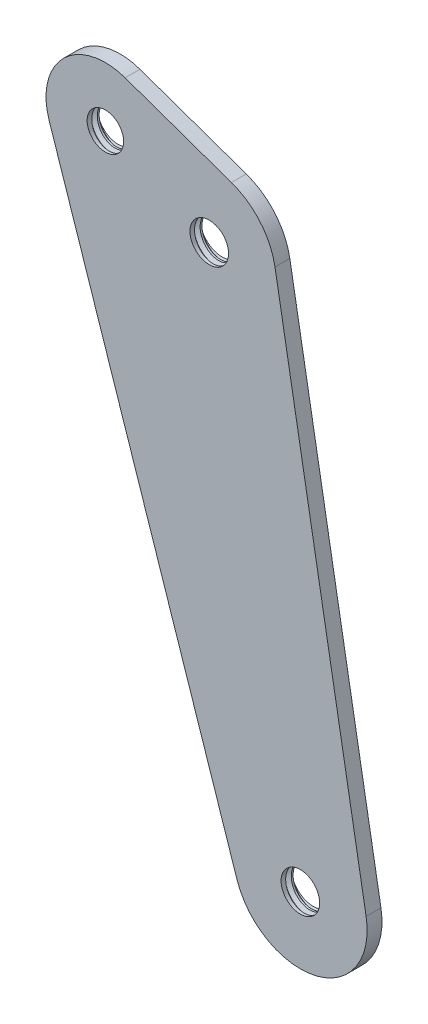
from build123d import *

# Parameters (mm, degrees)
SK_PLACA_JAULA_EXTERIOR_R   = 2.46
SK_PLACA_JAULA_EXTERIOR_R_2 = 2.6
PLACA_JAULA_EXTERIOR_DEPTH  = 2
ROSCA_M6X1_PITCH            = 1
ROSCA1_PITCH                = 1
ROSCA2_PITCH                = 1


with BuildPart() as part:
    # Sk_Placa_jaula_exterior → Placa_jaula_exterior (new body)
    with BuildSketch(Plane.XY.offset(4.2)):
        with BuildLine():
            Line((-43.589272619, -64.530403351), (-18.252323126, -140.521852295))
            ThreePointArc((-18.252323126, -140.521852295), (-7.503629985, -146.399398283), (-0.851121653, -136.112314927))
            Line((-0.851121653, -136.112314927), (-13.136730223, -66.437166401))
            ThreePointArc((-13.136730223, -66.437166401), (-15.134246462, -62.180942658), (-19.005478688, -59.512783606))
            Line((-19.005478688, -59.512783606), (-33.338203279, -54.45580765))
            ThreePointArc((-33.338203279, -54.45580765), (-41.60752836, -56.294246265), (-43.589272619, -64.530403351))
        make_face()
        with Locations((-36, -62)):
            Circle(SK_PLACA_JAULA_EXTERIOR_R, mode=Mode.SUBTRACT)
        with Locations((-22, -68)):
            Circle(SK_PLACA_JAULA_EXTERIOR_R_2, mode=Mode.SUBTRACT)
        with Locations((-9.71439143, -137.675148526)):
            Circle(SK_PLACA_JAULA_EXTERIOR_R_2, mode=Mode.SUBTRACT)
    extrude(amount=PLACA_JAULA_EXTERIOR_DEPTH)

    # Rosca_M6x1: the profile of Perfil de rosca1 profile screwed along a right-hand helix of 2 turns, 8 arcs to a turn; built about Z, then put on its axis
    rosca_m6x1_z = Axis((0, 0, 0), (0, 0, 1))
    rosca_m6x1_corners = [(2.4597, 0, -0.000173205), (3.001265875, 0, 0.312499999), (3.001265875, 0, 0.437499999), (2.4597, 0, 0.750173202)]
    with BuildLine(mode=Mode.PRIVATE) as rosca_m6x1_profile:
        Line(rosca_m6x1_corners[0], rosca_m6x1_corners[1])
        Line(rosca_m6x1_corners[1], rosca_m6x1_corners[2])
        Line(rosca_m6x1_corners[2], rosca_m6x1_corners[3])
        Line(rosca_m6x1_corners[3], rosca_m6x1_corners[0])
    rosca_m6x1_cap = Face(rosca_m6x1_profile.wire())
    rosca_m6x1_turn_angles = [0, 22.5, 45, 67.5, 90, 112.5, 135, 157.5, 180, 202.5, 225, 247.5, 270, 292.5, 315, 337.5, 360]
    rosca_m6x1_turn_weights = [1, 0.9238795325112867, 1, 0.9238795325112867, 1, 0.9238795325112867, 1, 0.9238795325112867, 1, 0.9238795325112867, 1, 0.9238795325112867, 1, 0.9238795325112867, 1, 0.9238795325112867, 1]
    rosca_m6x1_turn_rails = [Edge.make_bspline([Vector(p[0], p[1], 0).rotate(rosca_m6x1_z, rosca_m6x1_turn_angles[k]) / rosca_m6x1_turn_weights[k] + Vector(0, 0, p[2] + ROSCA_M6X1_PITCH * rosca_m6x1_turn_angles[k] / 360) for k in range(17)], [0, 0, 0, 1, 1, 2, 2, 3, 3, 4, 4, 5, 5, 6, 6, 7, 7, 8, 8, 8], 2, rosca_m6x1_turn_weights) for p in rosca_m6x1_corners]
    rosca_m6x1_turn_sides = [Face.make_surface_from_curves(rosca_m6x1_turn_rails[p[0]], rosca_m6x1_turn_rails[p[1]]) for p in [(0, 1), (1, 2), (2, 3), (3, 0)]]
    rosca_m6x1 = Plane(origin=(-36, -62, 6.2), x_dir=(0.707106781, 0.707106781, 0), z_dir=(0, 0, -1)) * Solid(Shell([*[p.moved(Location((0, 0, ROSCA_M6X1_PITCH * i))) for i in range(2) for p in rosca_m6x1_turn_sides], rosca_m6x1_cap, rosca_m6x1_cap.rotate(rosca_m6x1_z, 720).moved(Location((0, 0, ROSCA_M6X1_PITCH * 720 / 360)))]))
    add(rosca_m6x1, mode=Mode.SUBTRACT)

    # Rosca1: the profile of Perfil de rosca2 profile screwed along a right-hand helix of 2 turns, 8 arcs to a turn; built about Z, then put on its axis
    rosca1_z = Axis((0, 0, 0), (0, 0, 1))
    rosca1_corners = [(2.5997, 0, -0.000173205), (3.141265875, 0, 0.312499999), (3.141265875, 0, 0.437499999), (2.5997, 0, 0.750173202)]
    with BuildLine(mode=Mode.PRIVATE) as rosca1_profile:
        Line(rosca1_corners[0], rosca1_corners[1])
        Line(rosca1_corners[1], rosca1_corners[2])
        Line(rosca1_corners[2], rosca1_corners[3])
        Line(rosca1_corners[3], rosca1_corners[0])
    rosca1_cap = Face(rosca1_profile.wire())
    rosca1_turn_angles = [0, 22.5, 45, 67.5, 90, 112.5, 135, 157.5, 180, 202.5, 225, 247.5, 270, 292.5, 315, 337.5, 360]
    rosca1_turn_weights = [1, 0.9238795325112867, 1, 0.9238795325112867, 1, 0.9238795325112867, 1, 0.9238795325112867, 1, 0.9238795325112867, 1, 0.9238795325112867, 1, 0.9238795325112867, 1, 0.9238795325112867, 1]
    rosca1_turn_rails = [Edge.make_bspline([Vector(p[0], p[1], 0).rotate(rosca1_z, rosca1_turn_angles[k]) / rosca1_turn_weights[k] + Vector(0, 0, p[2] + ROSCA1_PITCH * rosca1_turn_angles[k] / 360) for k in range(17)], [0, 0, 0, 1, 1, 2, 2, 3, 3, 4, 4, 5, 5, 6, 6, 7, 7, 8, 8, 8], 2, rosca1_turn_weights) for p in rosca1_corners]
    rosca1_turn_sides = [Face.make_surface_from_curves(rosca1_turn_rails[p[0]], rosca1_turn_rails[p[1]]) for p in [(0, 1), (1, 2), (2, 3), (3, 0)]]
    rosca1 = Plane(origin=(-9.71439143, -137.675148526, 6.2), x_dir=(0.707106781, 0.707106781, 0), z_dir=(0, 0, -1)) * Solid(Shell([*[p.moved(Location((0, 0, ROSCA1_PITCH * i))) for i in range(2) for p in rosca1_turn_sides], rosca1_cap, rosca1_cap.rotate(rosca1_z, 720).moved(Location((0, 0, ROSCA1_PITCH * 720 / 360)))]))
    add(rosca1, mode=Mode.SUBTRACT)

    # Rosca2: the profile of Perfil de rosca3 profile screwed along a right-hand helix of 2 turns, 8 arcs to a turn; built about Z, then put on its axis
    rosca2_z = Axis((0, 0, 0), (0, 0, 1))
    rosca2_corners = [(2.5997, 0, -0.000173205), (3.141265875, 0, 0.312499999), (3.141265875, 0, 0.437499999), (2.5997, 0, 0.750173202)]
    with BuildLine(mode=Mode.PRIVATE) as rosca2_profile:
        Line(rosca2_corners[0], rosca2_corners[1])
        Line(rosca2_corners[1], rosca2_corners[2])
        Line(rosca2_corners[2], rosca2_corners[3])
        Line(rosca2_corners[3], rosca2_corners[0])
    rosca2_cap = Face(rosca2_profile.wire())
    rosca2_turn_angles = [0, 22.5, 45, 67.5, 90, 112.5, 135, 157.5, 180, 202.5, 225, 247.5, 270, 292.5, 315, 337.5, 360]
    rosca2_turn_weights = [1, 0.9238795325112867, 1, 0.9238795325112867, 1, 0.9238795325112867, 1, 0.9238795325112867, 1, 0.9238795325112867, 1, 0.9238795325112867, 1, 0.9238795325112867, 1, 0.9238795325112867, 1]
    rosca2_turn_rails = [Edge.make_bspline([Vector(p[0], p[1], 0).rotate(rosca2_z, rosca2_turn_angles[k]) / rosca2_turn_weights[k] + Vector(0, 0, p[2] + ROSCA2_PITCH * rosca2_turn_angles[k] / 360) for k in range(17)], [0, 0, 0, 1, 1, 2, 2, 3, 3, 4, 4, 5, 5, 6, 6, 7, 7, 8, 8, 8], 2, rosca2_turn_weights) for p in rosca2_corners]
    rosca2_turn_sides = [Face.make_surface_from_curves(rosca2_turn_rails[p[0]], rosca2_turn_rails[p[1]]) for p in [(0, 1), (1, 2), (2, 3), (3, 0)]]
    rosca2 = Plane(origin=(-22, -68, 6.2), x_dir=(0.707106781, 0.707106781, 0), z_dir=(0, 0, -1)) * Solid(Shell([*[p.moved(Location((0, 0, ROSCA2_PITCH * i))) for i in range(2) for p in rosca2_turn_sides], rosca2_cap, rosca2_cap.rotate(rosca2_z, 720).moved(Location((0, 0, ROSCA2_PITCH * 720 / 360)))]))
    add(rosca2, mode=Mode.SUBTRACT)


solid = part.part
